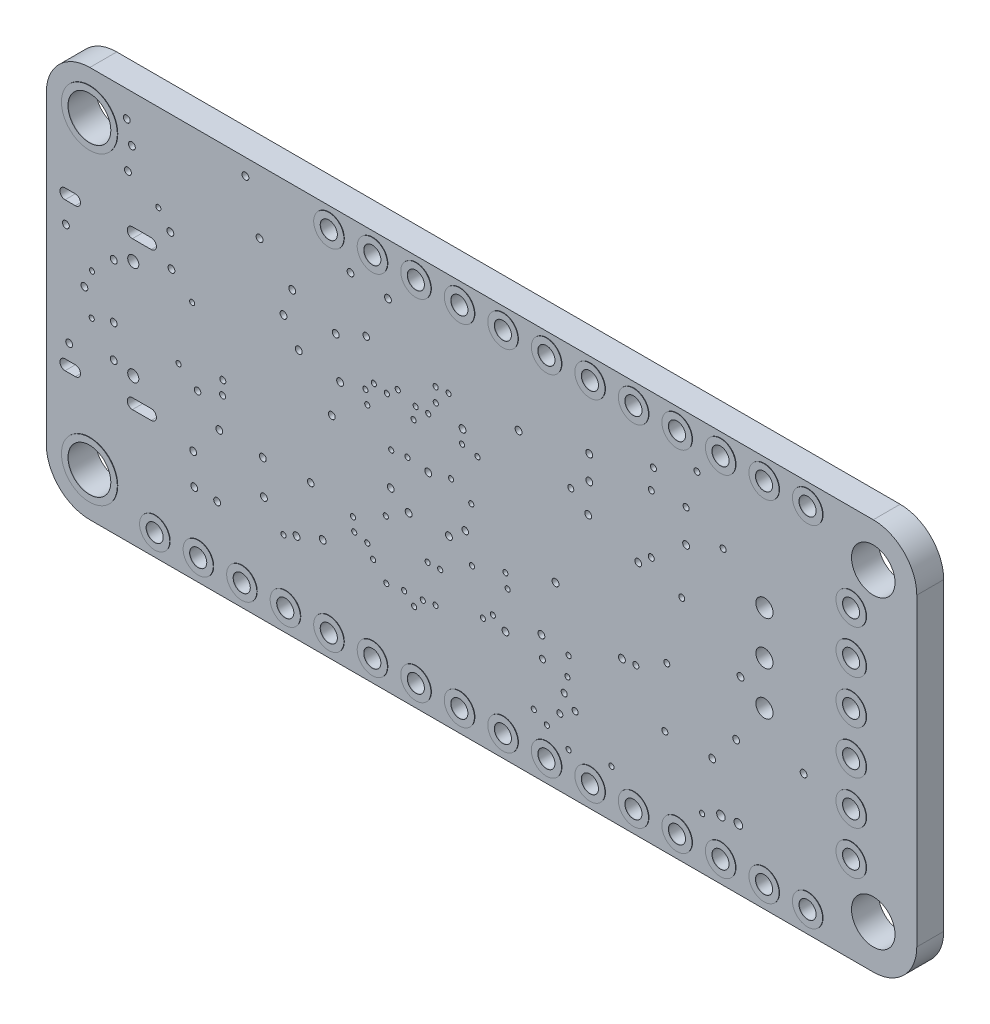
from build123d import *

# Parameters (mm, degrees)
SKETCH1_R              = 1.27
SKETCH1_R_2            = 0.5
SKETCH1_R_3            = 0.325
SKETCH1_R_4            = 1.25
SKETCH1_R_5            = 0.175
SKETCH1_R_6            = 0.15
SKETCH1_R_7            = 0.197
SKETCH1_R_8            = 0.1905
SKETCH1_R_9            = 0.2
SKETCH1_R_10           = 0.25
BOSS_EXTRUDE1_DEPTH    = 1.57
SKETCH2_R              = 0.881
SKETCH2_R_2            = 0.5
BOSS_EXTRUDE2_DEPTH    = 0.0254
BOSS_EXTRUDE2_2_DEPTH  = 0.0254
BOSS_EXTRUDE2_3_DEPTH  = 0.0254
BOSS_EXTRUDE2_4_DEPTH  = 0.0254
BOSS_EXTRUDE2_5_DEPTH  = 0.0254
BOSS_EXTRUDE2_6_DEPTH  = 0.0254
BOSS_EXTRUDE2_7_DEPTH  = 0.0254
BOSS_EXTRUDE2_8_DEPTH  = 0.0254
BOSS_EXTRUDE2_9_DEPTH  = 0.0254
BOSS_EXTRUDE2_10_DEPTH = 0.0254
BOSS_EXTRUDE2_11_DEPTH = 0.0254
BOSS_EXTRUDE2_12_DEPTH = 0.0254
BOSS_EXTRUDE2_13_DEPTH = 0.0254
BOSS_EXTRUDE2_14_DEPTH = 0.0254
BOSS_EXTRUDE2_15_DEPTH = 0.0254
BOSS_EXTRUDE2_16_DEPTH = 0.0254
BOSS_EXTRUDE2_17_DEPTH = 0.0254
BOSS_EXTRUDE2_18_DEPTH = 0.0254
BOSS_EXTRUDE2_19_DEPTH = 0.0254
BOSS_EXTRUDE2_20_DEPTH = 0.0254
BOSS_EXTRUDE2_21_DEPTH = 0.0254
BOSS_EXTRUDE2_22_DEPTH = 0.0254
BOSS_EXTRUDE2_23_DEPTH = 0.0254
BOSS_EXTRUDE2_24_DEPTH = 0.0254
BOSS_EXTRUDE2_25_DEPTH = 0.0254
BOSS_EXTRUDE2_26_DEPTH = 0.0254
BOSS_EXTRUDE2_27_DEPTH = 0.0254
BOSS_EXTRUDE2_28_DEPTH = 0.0254
BOSS_EXTRUDE2_29_DEPTH = 0.0254
BOSS_EXTRUDE2_30_DEPTH = 0.0254
BOSS_EXTRUDE2_31_DEPTH = 0.0254
BOSS_EXTRUDE2_32_DEPTH = 0.0254
BOSS_EXTRUDE2_33_DEPTH = 0.0254
BOSS_EXTRUDE2_34_DEPTH = 0.0254
SKETCH2_R_3            = 1.631
SKETCH2_R_4            = 1.25
BOSS_EXTRUDE2_35_DEPTH = 0.0254
BOSS_EXTRUDE2_36_DEPTH = 0.0254


with BuildPart() as part:
    # Sketch1 → Boss-Extrude1 (new body)
    with BuildSketch(Plane(origin=(0, 0, 0), x_dir=(-1, 0, 0), z_dir=(0, 0, -1))):
        with BuildLine():
            Line((0, 2.54), (0, 20.32))
            ThreePointArc((0, 20.32), (-0.743948776, 22.116051224), (-2.54, 22.86))
            Line((-2.54, 22.86), (-48.26, 22.86))
            ThreePointArc((-48.26, 22.86), (-50.056051224, 22.116051224), (-50.8, 20.32))
            Line((-50.8, 20.32), (-50.8, 2.54))
            ThreePointArc((-50.8, 2.54), (-50.056051224, 0.743948776), (-48.26, 0))
            Line((-48.26, 0), (-2.54, 0))
            ThreePointArc((-2.54, 0), (-0.743948776, 0.743948776), (0, 2.54))
        make_face()
        with Locations(Location((-48.26, 2.54, 0), (0, 0, 180))):
            Circle(SKETCH1_R, mode=Mode.SUBTRACT)
        with Locations(Location((-48.26, 20.32, 0), (0, 0, 180))):
            Circle(SKETCH1_R, mode=Mode.SUBTRACT)
        with Locations(Location((-41.91, 15.24, 0), (0, 0, 180))):
            Circle(SKETCH1_R_2, mode=Mode.SUBTRACT)
        with Locations(Location((-41.91, 10.16, 0), (0, 0, 180))):
            Circle(SKETCH1_R_2, mode=Mode.SUBTRACT)
        with Locations(Location((-46.99, 7.62, 0), (0, 0, 180))):
            Circle(SKETCH1_R_2, mode=Mode.SUBTRACT)
        with Locations(Location((-46.99, 12.7, 0), (0, 0, 180))):
            Circle(SKETCH1_R_2, mode=Mode.SUBTRACT)
        with Locations(Location((-46.99, 17.78, 0), (0, 0, 180))):
            Circle(SKETCH1_R_2, mode=Mode.SUBTRACT)
        with Locations(Location((-5.074, 8.54, 0), (0, 0, 180))):
            Circle(SKETCH1_R_3, mode=Mode.SUBTRACT)
        with Locations(Location((-41.91, 21.654, 0), (0, 0, 180))):
            Circle(SKETCH1_R_2, mode=Mode.SUBTRACT)
        with Locations(Location((-36.83, 21.654, 0), (0, 0, 180))):
            Circle(SKETCH1_R_2, mode=Mode.SUBTRACT)
        with Locations(Location((-31.75, 21.654, 0), (0, 0, 180))):
            Circle(SKETCH1_R_2, mode=Mode.SUBTRACT)
        with Locations(Location((-26.67, 21.654, 0), (0, 0, 180))):
            Circle(SKETCH1_R_2, mode=Mode.SUBTRACT)
        with Locations(Location((-21.59, 21.654, 0), (0, 0, 180))):
            Circle(SKETCH1_R_2, mode=Mode.SUBTRACT)
        with Locations(Location((-16.51, 21.654, 0), (0, 0, 180))):
            Circle(SKETCH1_R_2, mode=Mode.SUBTRACT)
        with Locations(Location((-8.89, 1.27, 0), (0, 0, 180))):
            Circle(SKETCH1_R_2, mode=Mode.SUBTRACT)
        with Locations(Location((-13.97, 1.27, 0), (0, 0, 180))):
            Circle(SKETCH1_R_2, mode=Mode.SUBTRACT)
        with Locations(Location((-19.05, 1.27, 0), (0, 0, 180))):
            Circle(SKETCH1_R_2, mode=Mode.SUBTRACT)
        with Locations(Location((-24.13, 1.27, 0), (0, 0, 180))):
            Circle(SKETCH1_R_2, mode=Mode.SUBTRACT)
        with Locations(Location((-29.21, 1.27, 0), (0, 0, 180))):
            Circle(SKETCH1_R_2, mode=Mode.SUBTRACT)
        with Locations(Location((-34.29, 1.27, 0), (0, 0, 180))):
            Circle(SKETCH1_R_2, mode=Mode.SUBTRACT)
        with Locations(Location((-39.37, 1.27, 0), (0, 0, 180))):
            Circle(SKETCH1_R_2, mode=Mode.SUBTRACT)
        with Locations(Location((-44.45, 1.27, 0), (0, 0, 180))):
            Circle(SKETCH1_R_2, mode=Mode.SUBTRACT)
        with Locations(Location((-2.54, 20.32, 0), (0, 0, 180))):
            Circle(SKETCH1_R_4, mode=Mode.SUBTRACT)
        with Locations(Location((-37.084, 13.335, 0), (0, 0, 180))):
            Circle(SKETCH1_R_5, mode=Mode.SUBTRACT)
        with Locations(Location((-30.416, 5.997, 0), (0, 0, 180))):
            Circle(SKETCH1_R_6, mode=Mode.SUBTRACT)
        with Locations(Location((-30.861, 4.488, 0), (0, 0, 180))):
            Circle(SKETCH1_R_5, mode=Mode.SUBTRACT)
        with Locations(Location((-29.969, 3.92, 0), (0, 0, 180))):
            Circle(SKETCH1_R_5, mode=Mode.SUBTRACT)
        with Locations(Location((-36.101, 6.087, 0), (0, 0, 180))):
            Circle(SKETCH1_R_5, mode=Mode.SUBTRACT)
        with Locations(Location((-17.97, 7.099, 0), (0, 0, 180))):
            Circle(SKETCH1_R_6, mode=Mode.SUBTRACT)
        with Locations(Location((-18.732, 6.922, 0), (0, 0, 180))):
            Circle(SKETCH1_R_6, mode=Mode.SUBTRACT)
        with Locations(Location((-17.9, 7.831, 0), (0, 0, 180))):
            Circle(SKETCH1_R_6, mode=Mode.SUBTRACT)
        with Locations(Location((-21.971, 5.652, 0), (0, 0, 180))):
            Circle(SKETCH1_R_6, mode=Mode.SUBTRACT)
        with Locations(Location((-39.497, 17.018, 0), (0, 0, 180))):
            Circle(SKETCH1_R_5, mode=Mode.SUBTRACT)
        with Locations(Location((-30.223, 5.083, 0), (0, 0, 180))):
            Circle(SKETCH1_R_5, mode=Mode.SUBTRACT)
        with Locations(Location((-13.843, 4.89, 0), (0, 0, 180))):
            Circle(SKETCH1_R_6, mode=Mode.SUBTRACT)
        with Locations(Location((-2.667, 12.636, 0), (0, 0, 180))):
            Circle(SKETCH1_R_6, mode=Mode.SUBTRACT)
        with Locations(Location((-26.06, 6.947, 0), (0, 0, 180))):
            Circle(SKETCH1_R_6, mode=Mode.SUBTRACT)
        with Locations(Location((-24.259, 14.685, 0), (0, 0, 180))):
            Circle(SKETCH1_R_6, mode=Mode.SUBTRACT)
        with Locations(Location((-24.846, 8.826, 0), (0, 0, 180))):
            Circle(SKETCH1_R_6, mode=Mode.SUBTRACT)
        with Locations(Location((-28.956, 6.167, 0), (0, 0, 180))):
            Circle(SKETCH1_R_5, mode=Mode.SUBTRACT)
        with Locations(Location((-32.984, 2.766, 0), (0, 0, 180))):
            Circle(SKETCH1_R_6, mode=Mode.SUBTRACT)
        with Locations(Location((-23.622, 12.609, 0), (0, 0, 180))):
            Circle(SKETCH1_R_6, mode=Mode.SUBTRACT)
        with Locations(Location((-22.72, 5.766, 0), (0, 0, 180))):
            Circle(SKETCH1_R_6, mode=Mode.SUBTRACT)
        with Locations(Location((-4.699, 21.336, 0), (0, 0, 180))):
            Circle(SKETCH1_R_7, mode=Mode.SUBTRACT)
        with Locations(Location((-26.924, 8.694, 0), (0, 0, 180))):
            Circle(SKETCH1_R_6, mode=Mode.SUBTRACT)
        with Locations(Location((-26.792, 9.452, 0), (0, 0, 180))):
            Circle(SKETCH1_R_6, mode=Mode.SUBTRACT)
        with Locations(Location((-22.728, 16.002, 0), (0, 0, 180))):
            Circle(SKETCH1_R_6, mode=Mode.SUBTRACT)
        with Locations(Location((-20.51, 15.558, 0), (0, 0, 180))):
            Circle(SKETCH1_R_6, mode=Mode.SUBTRACT)
        with Locations(Location((-23.479, 16.86, 0), (0, 0, 180))):
            Circle(SKETCH1_R_6, mode=Mode.SUBTRACT)
        with Locations(Location((-37.338, 18.034, 0), (0, 0, 180))):
            Circle(SKETCH1_R_5, mode=Mode.SUBTRACT)
        with Locations(Location((-22.722, 16.814, 0), (0, 0, 180))):
            Circle(SKETCH1_R_6, mode=Mode.SUBTRACT)
        with Locations(Location((-18.732, 13.906, 0), (0, 0, 180))):
            Circle(SKETCH1_R_6, mode=Mode.SUBTRACT)
        with Locations(Location((-18.669, 17.336, 0), (0, 0, 180))):
            Circle(SKETCH1_R_8, mode=Mode.SUBTRACT)
        with Locations(Location((-4.762, 18.732, 0), (0, 0, 180))):
            Circle(SKETCH1_R_9, mode=Mode.SUBTRACT)
        with Locations(Location((-3.937, 8.763, 0), (0, 0, 180))):
            Circle(SKETCH1_R_9, mode=Mode.SUBTRACT)
        with Locations(Location((-35.306, 14.478, 0), (0, 0, 180))):
            Circle(SKETCH1_R_5, mode=Mode.SUBTRACT)
        with Locations(Location((-24.29, 15.466, 0), (0, 0, 180))):
            Circle(SKETCH1_R_9, mode=Mode.SUBTRACT)
        with Locations(Location((-15.43, 8.318, 0), (0, 0, 180))):
            Circle(SKETCH1_R_8, mode=Mode.SUBTRACT)
        with Locations(Location((-16.662, 12.333, 0), (0, 0, 180))):
            Circle(SKETCH1_R_7, mode=Mode.SUBTRACT)
        with Locations(Location((-19.114, 15.176, 0), (0, 0, 180))):
            Circle(SKETCH1_R_6, mode=Mode.SUBTRACT)
        with Locations(Location((-22.255, 7.711, 0), (0, 0, 180))):
            Circle(SKETCH1_R_6, mode=Mode.SUBTRACT)
        with Locations(Location((-21.553, 15.233, 0), (0, 0, 180))):
            Circle(SKETCH1_R_6, mode=Mode.SUBTRACT)
        with Locations(Location((-44.196, 8.001, 0), (0, 0, 180))):
            Circle(SKETCH1_R_9, mode=Mode.SUBTRACT)
        with Locations(Location((-40.513, 11.049, 0), (0, 0, 180))):
            Circle(SKETCH1_R_9, mode=Mode.SUBTRACT)
        with Locations(Location((-26.797, 6.477, 0), (0, 0, 180))):
            Circle(SKETCH1_R_9, mode=Mode.SUBTRACT)
        with Locations(Location((-37.338, 16.129, 0), (0, 0, 180))):
            Circle(SKETCH1_R_9, mode=Mode.SUBTRACT)
        with Locations(Location((-38.862, 6.096, 0), (0, 0, 180))):
            Circle(SKETCH1_R_9, mode=Mode.SUBTRACT)
        with Locations(Location((-31.686, 17.907, 0), (0, 0, 180))):
            Circle(SKETCH1_R_9, mode=Mode.SUBTRACT)
        with Locations(Location((-31.623, 14.796, 0), (0, 0, 180))):
            Circle(SKETCH1_R_9, mode=Mode.SUBTRACT)
        with Locations(Location((-12.446, 19.177, 0), (0, 0, 180))):
            Circle(SKETCH1_R_9, mode=Mode.SUBTRACT)
        with Locations(Location((-7.302, 15.05, 0), (0, 0, 180))):
            Circle(SKETCH1_R_9, mode=Mode.SUBTRACT)
        with Locations(Location((-1.143, 14.224, 0), (0, 0, 180))):
            Circle(SKETCH1_R_9, mode=Mode.SUBTRACT)
        with Locations(Location((-2.222, 11.62, 0), (0, 0, 180))):
            Circle(SKETCH1_R_9, mode=Mode.SUBTRACT)
        with Locations(Location((-14.605, 5.207, 0), (0, 0, 180))):
            Circle(SKETCH1_R_9, mode=Mode.SUBTRACT)
        with Locations(Location((-14.732, 14.668, 0), (0, 0, 180))):
            Circle(SKETCH1_R_9, mode=Mode.SUBTRACT)
        with Locations(Location((-12.636, 8.192, 0), (0, 0, 180))):
            Circle(SKETCH1_R_9, mode=Mode.SUBTRACT)
        with Locations(Location((-16.891, 16.574, 0), (0, 0, 180))):
            Circle(SKETCH1_R_9, mode=Mode.SUBTRACT)
        with Locations(Location((-28.892, 7.366, 0), (0, 0, 180))):
            Circle(SKETCH1_R_9, mode=Mode.SUBTRACT)
        with Locations(Location((-23.495, 9.652, 0), (0, 0, 180))):
            Circle(SKETCH1_R_9, mode=Mode.SUBTRACT)
        with Locations(Location((-12.7, 6.223, 0), (0, 0, 180))):
            Circle(SKETCH1_R_9, mode=Mode.SUBTRACT)
        with Locations(Location((-8.572, 6.477, 0), (0, 0, 180))):
            Circle(SKETCH1_R_9, mode=Mode.SUBTRACT)
        with Locations(Location((-4.995, 20.13, 0), (0, 0, 180))):
            Circle(SKETCH1_R_9, mode=Mode.SUBTRACT)
        with Locations(Location((-10.096, 8.318, 0), (0, 0, 180))):
            Circle(SKETCH1_R_9, mode=Mode.SUBTRACT)
        with Locations(Location((-9.97, 4.636, 0), (0, 0, 180))):
            Circle(SKETCH1_R_9, mode=Mode.SUBTRACT)
        with Locations(Location((-16.129, 5.778, 0), (0, 0, 180))):
            Circle(SKETCH1_R_9, mode=Mode.SUBTRACT)
        with Locations(Location((-21.146, 9.652, 0), (0, 0, 180))):
            Circle(SKETCH1_R_9, mode=Mode.SUBTRACT)
        with Locations(Location((-13.843, 16.002, 0), (0, 0, 180))):
            Circle(SKETCH1_R_9, mode=Mode.SUBTRACT)
        with Locations(Location((-27.559, 17.018, 0), (0, 0, 180))):
            Circle(SKETCH1_R_9, mode=Mode.SUBTRACT)
        with Locations(Location((-17.145, 14.262, 0), (0, 0, 180))):
            Circle(SKETCH1_R_9, mode=Mode.SUBTRACT)
        with Locations(Location((-8.636, 4.699, 0), (0, 0, 180))):
            Circle(SKETCH1_R_9, mode=Mode.SUBTRACT)
        with Locations(Location((-22.288, 12.268, 0), (0, 0, 180))):
            Circle(SKETCH1_R_9, mode=Mode.SUBTRACT)
        with Locations(Location((-1.334, 8.318, 0), (0, 0, 180))):
            Circle(SKETCH1_R_9, mode=Mode.SUBTRACT)
        with Locations(Location((-7.239, 16.891, 0), (0, 0, 180))):
            Circle(SKETCH1_R_9, mode=Mode.SUBTRACT)
        with Locations(Location((-19.939, 19.876, 0), (0, 0, 180))):
            Circle(SKETCH1_R_9, mode=Mode.SUBTRACT)
        with Locations(Location((-14.351, 17.526, 0), (0, 0, 180))):
            Circle(SKETCH1_R_9, mode=Mode.SUBTRACT)
        with Locations(Location((-31.686, 16.51, 0), (0, 0, 180))):
            Circle(SKETCH1_R_9, mode=Mode.SUBTRACT)
        with Locations(Location((-29.718, 10.414, 0), (0, 0, 180))):
            Circle(SKETCH1_R_9, mode=Mode.SUBTRACT)
        with Locations(Location((-40.386, 3.556, 0), (0, 0, 180))):
            Circle(SKETCH1_R_10, mode=Mode.SUBTRACT)
        with Locations(Location((-33.592, 8.509, 0), (0, 0, 180))):
            Circle(SKETCH1_R_9, mode=Mode.SUBTRACT)
        with Locations(Location((-34.544, 13.843, 0), (0, 0, 180))):
            Circle(SKETCH1_R_9, mode=Mode.SUBTRACT)
        with Locations(Location((-40.259, 7.747, 0), (0, 0, 180))):
            Circle(SKETCH1_R_9, mode=Mode.SUBTRACT)
        with Locations(Location((-20.13, 12.319, 0), (0, 0, 180))):
            Circle(SKETCH1_R_6, mode=Mode.SUBTRACT)
        with Locations(Location((-21.077, 12.429, 0), (0, 0, 180))):
            Circle(SKETCH1_R_6, mode=Mode.SUBTRACT)
        with Locations(Location((-25.477, 6.496, 0), (0, 0, 180))):
            Circle(SKETCH1_R_6, mode=Mode.SUBTRACT)
        with Locations(Location((-18.624, 14.631, 0), (0, 0, 180))):
            Circle(SKETCH1_R_6, mode=Mode.SUBTRACT)
        with Locations(Location((-20.098, 10.382, 0), (0, 0, 180))):
            Circle(SKETCH1_R_7, mode=Mode.SUBTRACT)
        with Locations(Location((-24.447, 10.401, 0), (0, 0, 180))):
            Circle(SKETCH1_R_8, mode=Mode.SUBTRACT)
        with Locations(Location((-30.607, 15.629, 0), (0, 0, 180))):
            Circle(SKETCH1_R_5, mode=Mode.SUBTRACT)
        with Locations(Location((-3.937, 13.843, 0), (0, 0, 180))):
            Circle(SKETCH1_R_9, mode=Mode.SUBTRACT)
        with Locations(Location((-3.937, 10.668, 0), (0, 0, 180))):
            Circle(SKETCH1_R_9, mode=Mode.SUBTRACT)
        with Locations(Location((-8.826, 9.652, 0), (0, 0, 180))):
            Circle(SKETCH1_R_8, mode=Mode.SUBTRACT)
        with Locations(Location((-10.302, 10.942, 0), (0, 0, 180))):
            Circle(SKETCH1_R_5, mode=Mode.SUBTRACT)
        with Locations(Location((-6.54, 17.78, 0), (0, 0, 180))):
            Circle(SKETCH1_R_6, mode=Mode.SUBTRACT)
        with Locations(Location((-35.306, 17.872, 0), (0, 0, 180))):
            Circle(SKETCH1_R_5, mode=Mode.SUBTRACT)
        with Locations(Location((-37.973, 20.152, 0), (0, 0, 180))):
            Circle(SKETCH1_R_5, mode=Mode.SUBTRACT)
        with Locations(Location((-35.433, 19.075, 0), (0, 0, 180))):
            Circle(SKETCH1_R_5, mode=Mode.SUBTRACT)
        with Locations(Location((-22.288, 15.24, 0), (0, 0, 180))):
            Circle(SKETCH1_R_6, mode=Mode.SUBTRACT)
        with Locations(Location((-19.876, 15.05, 0), (0, 0, 180))):
            Circle(SKETCH1_R_6, mode=Mode.SUBTRACT)
        with Locations(Location((-7.722, 10.478, 0), (0, 0, 180))):
            Circle(SKETCH1_R_6, mode=Mode.SUBTRACT)
        with Locations(Location((-8.509, 13.97, 0), (0, 0, 180))):
            Circle(SKETCH1_R_6, mode=Mode.SUBTRACT)
        with Locations(Location((-17.753, 20.093, 0), (0, 0, 180))):
            Circle(SKETCH1_R_7, mode=Mode.SUBTRACT)
        with Locations(Location((-24.801, 11.938, 0), (0, 0, 180))):
            Circle(SKETCH1_R_6, mode=Mode.SUBTRACT)
        with Locations(Location((-11.62, 21.908, 0), (0, 0, 180))):
            Circle(SKETCH1_R_9, mode=Mode.SUBTRACT)
        with Locations(Location((-38.269, 3.02, 0), (0, 0, 180))):
            Circle(SKETCH1_R_6, mode=Mode.SUBTRACT)
        with Locations(Location((-19.812, 8.826, 0), (0, 0, 180))):
            Circle(SKETCH1_R_6, mode=Mode.SUBTRACT)
        with Locations(Location((-25.163, 14.502, 0), (0, 0, 180))):
            Circle(SKETCH1_R_6, mode=Mode.SUBTRACT)
        with Locations(Location((-22.987, 7.711, 0), (0, 0, 180))):
            Circle(SKETCH1_R_6, mode=Mode.SUBTRACT)
        with Locations(Location((-2.65, 10.24, 0), (0, 0, 180))):
            Circle(SKETCH1_R_6, mode=Mode.SUBTRACT)
        with Locations(Location((-21.432, 14.506, 0), (0, 0, 180))):
            Circle(SKETCH1_R_6, mode=Mode.SUBTRACT)
        with Locations(Location((-20.884, 5.588, 0), (0, 0, 180))):
            Circle(SKETCH1_R_6, mode=Mode.SUBTRACT)
        with Locations(Location((-36.21, 9.588, 0), (0, 0, 180))):
            Circle(SKETCH1_R_5, mode=Mode.SUBTRACT)
        with Locations(Location((-39.37, 3.463, 0), (0, 0, 180))):
            Circle(SKETCH1_R_10, mode=Mode.SUBTRACT)
        with Locations(Location((-30.48, 7.112, 0), (0, 0, 180))):
            Circle(SKETCH1_R_6, mode=Mode.SUBTRACT)
        with Locations(Location((-30.48, 2.35, 0), (0, 0, 180))):
            Circle(SKETCH1_R_6, mode=Mode.SUBTRACT)
        with Locations(Location((-28.448, 3.373, 0), (0, 0, 180))):
            Circle(SKETCH1_R_6, mode=Mode.SUBTRACT)
        with Locations(Location((-29.21, 2.957, 0), (0, 0, 180))):
            Circle(SKETCH1_R_6, mode=Mode.SUBTRACT)
        with Locations(Location((-19.071, 6.262, 0), (0, 0, 180))):
            Circle(SKETCH1_R_6, mode=Mode.SUBTRACT)
        with Locations(Location((-19.842, 5.434, 0), (0, 0, 180))):
            Circle(SKETCH1_R_6, mode=Mode.SUBTRACT)
        with Locations(Location((-21.463, 5.08, 0), (0, 0, 180))):
            Circle(SKETCH1_R_6, mode=Mode.SUBTRACT)
        with Locations(Location((-34.406, 8.583, 0), (0, 0, 180))):
            Circle(SKETCH1_R_5, mode=Mode.SUBTRACT)
        with Locations(Location((-10.287, 10.16, 0), (0, 0, 180))):
            Circle(SKETCH1_R_5, mode=Mode.SUBTRACT)
        with Locations(Location((-2.54, 2.54, 0), (0, 0, 180))):
            Circle(SKETCH1_R_4, mode=Mode.SUBTRACT)
        with Locations(Location((-41.91, 1.27, 0), (0, 0, 180))):
            Circle(SKETCH1_R_2, mode=Mode.SUBTRACT)
        with Locations(Location((-36.83, 1.27, 0), (0, 0, 180))):
            Circle(SKETCH1_R_2, mode=Mode.SUBTRACT)
        with Locations(Location((-31.75, 1.27, 0), (0, 0, 180))):
            Circle(SKETCH1_R_2, mode=Mode.SUBTRACT)
        with Locations(Location((-26.67, 1.27, 0), (0, 0, 180))):
            Circle(SKETCH1_R_2, mode=Mode.SUBTRACT)
        with Locations(Location((-21.59, 1.27, 0), (0, 0, 180))):
            Circle(SKETCH1_R_2, mode=Mode.SUBTRACT)
        with Locations(Location((-16.51, 1.27, 0), (0, 0, 180))):
            Circle(SKETCH1_R_2, mode=Mode.SUBTRACT)
        with Locations(Location((-11.43, 1.27, 0), (0, 0, 180))):
            Circle(SKETCH1_R_2, mode=Mode.SUBTRACT)
        with Locations(Location((-6.35, 1.27, 0), (0, 0, 180))):
            Circle(SKETCH1_R_2, mode=Mode.SUBTRACT)
        with Locations(Location((-19.05, 21.654, 0), (0, 0, 180))):
            Circle(SKETCH1_R_2, mode=Mode.SUBTRACT)
        with Locations(Location((-24.13, 21.654, 0), (0, 0, 180))):
            Circle(SKETCH1_R_2, mode=Mode.SUBTRACT)
        with Locations(Location((-29.21, 21.654, 0), (0, 0, 180))):
            Circle(SKETCH1_R_2, mode=Mode.SUBTRACT)
        with Locations(Location((-34.29, 21.654, 0), (0, 0, 180))):
            Circle(SKETCH1_R_2, mode=Mode.SUBTRACT)
        with Locations(Location((-39.37, 21.654, 0), (0, 0, 180))):
            Circle(SKETCH1_R_2, mode=Mode.SUBTRACT)
        with Locations(Location((-44.45, 21.654, 0), (0, 0, 180))):
            Circle(SKETCH1_R_2, mode=Mode.SUBTRACT)
        with Locations(Location((-5.074, 14.32, 0), (0, 0, 180))):
            Circle(SKETCH1_R_3, mode=Mode.SUBTRACT)
        with Locations(Location((-46.99, 15.24, 0), (0, 0, 180))):
            Circle(SKETCH1_R_2, mode=Mode.SUBTRACT)
        with Locations(Location((-46.99, 10.16, 0), (0, 0, 180))):
            Circle(SKETCH1_R_2, mode=Mode.SUBTRACT)
        with Locations(Location((-46.99, 5.08, 0), (0, 0, 180))):
            Circle(SKETCH1_R_2, mode=Mode.SUBTRACT)
        with Locations(Location((-41.91, 12.7, 0), (0, 0, 180))):
            Circle(SKETCH1_R_2, mode=Mode.SUBTRACT)
        with BuildLine():
            Line((-5.024, 6.81), (-6.124, 6.81))
            ThreePointArc((-6.124, 6.81), (-6.424, 7.11), (-6.124, 7.41))
            Line((-6.124, 7.41), (-5.024, 7.41))
            ThreePointArc((-5.024, 7.41), (-4.724, 7.11), (-5.024, 6.81))
        make_face(mode=Mode.SUBTRACT)
        with BuildLine():
            Line((-1.694, 16.05), (-1.094, 16.05))
            ThreePointArc((-1.094, 16.05), (-0.794, 15.75), (-1.094, 15.45))
            Line((-1.094, 15.45), (-1.694, 15.45))
            ThreePointArc((-1.694, 15.45), (-1.994, 15.75), (-1.694, 16.05))
        make_face(mode=Mode.SUBTRACT)
        with BuildLine():
            Line((-5.024, 15.45), (-6.124, 15.45))
            ThreePointArc((-6.124, 15.45), (-6.424, 15.75), (-6.124, 16.05))
            Line((-6.124, 16.05), (-5.024, 16.05))
            ThreePointArc((-5.024, 16.05), (-4.724, 15.75), (-5.024, 15.45))
        make_face(mode=Mode.SUBTRACT)
        with BuildLine():
            Line((-1.094, 6.81), (-1.694, 6.81))
            ThreePointArc((-1.694, 6.81), (-1.994, 7.11), (-1.694, 7.41))
            Line((-1.694, 7.41), (-1.094, 7.41))
            ThreePointArc((-1.094, 7.41), (-0.794, 7.11), (-1.094, 6.81))
        make_face(mode=Mode.SUBTRACT)
    extrude(amount=-BOSS_EXTRUDE1_DEPTH)


with BuildPart() as body_2:
    # Sketch2 → Boss-Extrude2 (new body)
    with BuildSketch(Plane.XY.offset(1.57)):
        with Locations((46.99, 5.08)):
            Circle(SKETCH2_R)
        with Locations((46.99, 5.08)):
            Circle(SKETCH2_R_2, mode=Mode.SUBTRACT)
    boss_extrude2 = extrude(amount=BOSS_EXTRUDE2_DEPTH)


with BuildPart() as body_3:
    # Sketch2 → Boss-Extrude2 2 (new body)
    with BuildSketch(Plane.XY.offset(1.57)):
        with Locations((46.99, 7.62)):
            Circle(SKETCH2_R)
        with Locations((46.99, 7.62)):
            Circle(SKETCH2_R_2, mode=Mode.SUBTRACT)
    boss_extrude2_2 = extrude(amount=BOSS_EXTRUDE2_2_DEPTH)


with BuildPart() as body_4:
    # Sketch2 → Boss-Extrude2 3 (new body)
    with BuildSketch(Plane.XY.offset(1.57)):
        with Locations((46.99, 10.16)):
            Circle(SKETCH2_R)
        with Locations((46.99, 10.16)):
            Circle(SKETCH2_R_2, mode=Mode.SUBTRACT)
    boss_extrude2_3 = extrude(amount=BOSS_EXTRUDE2_3_DEPTH)


with BuildPart() as body_5:
    # Sketch2 → Boss-Extrude2 4 (new body)
    with BuildSketch(Plane.XY.offset(1.57)):
        with Locations((46.99, 12.7)):
            Circle(SKETCH2_R)
        with Locations((46.99, 12.7)):
            Circle(SKETCH2_R_2, mode=Mode.SUBTRACT)
    boss_extrude2_4 = extrude(amount=BOSS_EXTRUDE2_4_DEPTH)


with BuildPart() as body_6:
    # Sketch2 → Boss-Extrude2 5 (new body)
    with BuildSketch(Plane.XY.offset(1.57)):
        with Locations((46.99, 15.24)):
            Circle(SKETCH2_R)
        with Locations((46.99, 15.24)):
            Circle(SKETCH2_R_2, mode=Mode.SUBTRACT)
    boss_extrude2_5 = extrude(amount=BOSS_EXTRUDE2_5_DEPTH)


with BuildPart() as body_7:
    # Sketch2 → Boss-Extrude2 6 (new body)
    with BuildSketch(Plane.XY.offset(1.57)):
        with Locations((46.99, 17.78)):
            Circle(SKETCH2_R)
        with Locations((46.99, 17.78)):
            Circle(SKETCH2_R_2, mode=Mode.SUBTRACT)
    boss_extrude2_6 = extrude(amount=BOSS_EXTRUDE2_6_DEPTH)


with BuildPart() as body_8:
    # Sketch2 → Boss-Extrude2 7 (new body)
    with BuildSketch(Plane.XY.offset(1.57)):
        with Locations((44.45, 1.27)):
            Circle(SKETCH2_R)
        with Locations((44.45, 1.27)):
            Circle(SKETCH2_R_2, mode=Mode.SUBTRACT)
    boss_extrude2_7 = extrude(amount=BOSS_EXTRUDE2_7_DEPTH)


with BuildPart() as body_9:
    # Sketch2 → Boss-Extrude2 8 (new body)
    with BuildSketch(Plane.XY.offset(1.57)):
        with Locations((41.91, 1.27)):
            Circle(SKETCH2_R)
        with Locations((41.91, 1.27)):
            Circle(SKETCH2_R_2, mode=Mode.SUBTRACT)
    boss_extrude2_8 = extrude(amount=BOSS_EXTRUDE2_8_DEPTH)


with BuildPart() as body_10:
    # Sketch2 → Boss-Extrude2 9 (new body)
    with BuildSketch(Plane.XY.offset(1.57)):
        with Locations((39.37, 1.27)):
            Circle(SKETCH2_R)
        with Locations((39.37, 1.27)):
            Circle(SKETCH2_R_2, mode=Mode.SUBTRACT)
    boss_extrude2_9 = extrude(amount=BOSS_EXTRUDE2_9_DEPTH)


with BuildPart() as body_11:
    # Sketch2 → Boss-Extrude2 10 (new body)
    with BuildSketch(Plane.XY.offset(1.57)):
        with Locations((36.83, 1.27)):
            Circle(SKETCH2_R)
        with Locations((36.83, 1.27)):
            Circle(SKETCH2_R_2, mode=Mode.SUBTRACT)
    boss_extrude2_10 = extrude(amount=BOSS_EXTRUDE2_10_DEPTH)


with BuildPart() as body_12:
    # Sketch2 → Boss-Extrude2 11 (new body)
    with BuildSketch(Plane.XY.offset(1.57)):
        with Locations((34.29, 1.27)):
            Circle(SKETCH2_R)
        with Locations((34.29, 1.27)):
            Circle(SKETCH2_R_2, mode=Mode.SUBTRACT)
    boss_extrude2_11 = extrude(amount=BOSS_EXTRUDE2_11_DEPTH)


with BuildPart() as body_13:
    # Sketch2 → Boss-Extrude2 12 (new body)
    with BuildSketch(Plane.XY.offset(1.57)):
        with Locations((31.75, 1.27)):
            Circle(SKETCH2_R)
        with Locations((31.75, 1.27)):
            Circle(SKETCH2_R_2, mode=Mode.SUBTRACT)
    boss_extrude2_12 = extrude(amount=BOSS_EXTRUDE2_12_DEPTH)


with BuildPart() as body_14:
    # Sketch2 → Boss-Extrude2 13 (new body)
    with BuildSketch(Plane.XY.offset(1.57)):
        with Locations((29.21, 1.27)):
            Circle(SKETCH2_R)
        with Locations((29.21, 1.27)):
            Circle(SKETCH2_R_2, mode=Mode.SUBTRACT)
    boss_extrude2_13 = extrude(amount=BOSS_EXTRUDE2_13_DEPTH)


with BuildPart() as body_15:
    # Sketch2 → Boss-Extrude2 14 (new body)
    with BuildSketch(Plane.XY.offset(1.57)):
        with Locations((26.67, 1.27)):
            Circle(SKETCH2_R)
        with Locations((26.67, 1.27)):
            Circle(SKETCH2_R_2, mode=Mode.SUBTRACT)
    boss_extrude2_14 = extrude(amount=BOSS_EXTRUDE2_14_DEPTH)


with BuildPart() as body_16:
    # Sketch2 → Boss-Extrude2 15 (new body)
    with BuildSketch(Plane.XY.offset(1.57)):
        with Locations((24.13, 1.27)):
            Circle(SKETCH2_R)
        with Locations((24.13, 1.27)):
            Circle(SKETCH2_R_2, mode=Mode.SUBTRACT)
    boss_extrude2_15 = extrude(amount=BOSS_EXTRUDE2_15_DEPTH)


with BuildPart() as body_17:
    # Sketch2 → Boss-Extrude2 16 (new body)
    with BuildSketch(Plane.XY.offset(1.57)):
        with Locations((21.59, 1.27)):
            Circle(SKETCH2_R)
        with Locations((21.59, 1.27)):
            Circle(SKETCH2_R_2, mode=Mode.SUBTRACT)
    boss_extrude2_16 = extrude(amount=BOSS_EXTRUDE2_16_DEPTH)


with BuildPart() as body_18:
    # Sketch2 → Boss-Extrude2 17 (new body)
    with BuildSketch(Plane.XY.offset(1.57)):
        with Locations((19.05, 1.27)):
            Circle(SKETCH2_R)
        with Locations((19.05, 1.27)):
            Circle(SKETCH2_R_2, mode=Mode.SUBTRACT)
    boss_extrude2_17 = extrude(amount=BOSS_EXTRUDE2_17_DEPTH)


with BuildPart() as body_19:
    # Sketch2 → Boss-Extrude2 18 (new body)
    with BuildSketch(Plane.XY.offset(1.57)):
        with Locations((16.51, 1.27)):
            Circle(SKETCH2_R)
        with Locations((16.51, 1.27)):
            Circle(SKETCH2_R_2, mode=Mode.SUBTRACT)
    boss_extrude2_18 = extrude(amount=BOSS_EXTRUDE2_18_DEPTH)


with BuildPart() as body_20:
    # Sketch2 → Boss-Extrude2 19 (new body)
    with BuildSketch(Plane.XY.offset(1.57)):
        with Locations((13.97, 1.27)):
            Circle(SKETCH2_R)
        with Locations((13.97, 1.27)):
            Circle(SKETCH2_R_2, mode=Mode.SUBTRACT)
    boss_extrude2_19 = extrude(amount=BOSS_EXTRUDE2_19_DEPTH)


with BuildPart() as body_21:
    # Sketch2 → Boss-Extrude2 20 (new body)
    with BuildSketch(Plane.XY.offset(1.57)):
        with Locations((11.43, 1.27)):
            Circle(SKETCH2_R)
        with Locations((11.43, 1.27)):
            Circle(SKETCH2_R_2, mode=Mode.SUBTRACT)
    boss_extrude2_20 = extrude(amount=BOSS_EXTRUDE2_20_DEPTH)


with BuildPart() as body_22:
    # Sketch2 → Boss-Extrude2 21 (new body)
    with BuildSketch(Plane.XY.offset(1.57)):
        with Locations((8.89, 1.27)):
            Circle(SKETCH2_R)
        with Locations((8.89, 1.27)):
            Circle(SKETCH2_R_2, mode=Mode.SUBTRACT)
    boss_extrude2_21 = extrude(amount=BOSS_EXTRUDE2_21_DEPTH)


with BuildPart() as body_23:
    # Sketch2 → Boss-Extrude2 22 (new body)
    with BuildSketch(Plane.XY.offset(1.57)):
        with Locations((6.35, 1.27)):
            Circle(SKETCH2_R)
        with Locations((6.35, 1.27)):
            Circle(SKETCH2_R_2, mode=Mode.SUBTRACT)
    boss_extrude2_22 = extrude(amount=BOSS_EXTRUDE2_22_DEPTH)


with BuildPart() as body_24:
    # Sketch2 → Boss-Extrude2 23 (new body)
    with BuildSketch(Plane.XY.offset(1.57)):
        with Locations((44.45, 21.654)):
            Circle(SKETCH2_R)
        with Locations((44.45, 21.654)):
            Circle(SKETCH2_R_2, mode=Mode.SUBTRACT)
    boss_extrude2_23 = extrude(amount=BOSS_EXTRUDE2_23_DEPTH)


with BuildPart() as body_25:
    # Sketch2 → Boss-Extrude2 24 (new body)
    with BuildSketch(Plane.XY.offset(1.57)):
        with Locations((41.91, 21.654)):
            Circle(SKETCH2_R)
        with Locations((41.91, 21.654)):
            Circle(SKETCH2_R_2, mode=Mode.SUBTRACT)
    boss_extrude2_24 = extrude(amount=BOSS_EXTRUDE2_24_DEPTH)


with BuildPart() as body_26:
    # Sketch2 → Boss-Extrude2 25 (new body)
    with BuildSketch(Plane.XY.offset(1.57)):
        with Locations((39.37, 21.654)):
            Circle(SKETCH2_R)
        with Locations((39.37, 21.654)):
            Circle(SKETCH2_R_2, mode=Mode.SUBTRACT)
    boss_extrude2_25 = extrude(amount=BOSS_EXTRUDE2_25_DEPTH)


with BuildPart() as body_27:
    # Sketch2 → Boss-Extrude2 26 (new body)
    with BuildSketch(Plane.XY.offset(1.57)):
        with Locations((36.83, 21.654)):
            Circle(SKETCH2_R)
        with Locations((36.83, 21.654)):
            Circle(SKETCH2_R_2, mode=Mode.SUBTRACT)
    boss_extrude2_26 = extrude(amount=BOSS_EXTRUDE2_26_DEPTH)


with BuildPart() as body_28:
    # Sketch2 → Boss-Extrude2 27 (new body)
    with BuildSketch(Plane.XY.offset(1.57)):
        with Locations((34.29, 21.654)):
            Circle(SKETCH2_R)
        with Locations((34.29, 21.654)):
            Circle(SKETCH2_R_2, mode=Mode.SUBTRACT)
    boss_extrude2_27 = extrude(amount=BOSS_EXTRUDE2_27_DEPTH)


with BuildPart() as body_29:
    # Sketch2 → Boss-Extrude2 28 (new body)
    with BuildSketch(Plane.XY.offset(1.57)):
        with Locations((31.75, 21.654)):
            Circle(SKETCH2_R)
        with Locations((31.75, 21.654)):
            Circle(SKETCH2_R_2, mode=Mode.SUBTRACT)
    boss_extrude2_28 = extrude(amount=BOSS_EXTRUDE2_28_DEPTH)


with BuildPart() as body_30:
    # Sketch2 → Boss-Extrude2 29 (new body)
    with BuildSketch(Plane.XY.offset(1.57)):
        with Locations((29.21, 21.654)):
            Circle(SKETCH2_R)
        with Locations((29.21, 21.654)):
            Circle(SKETCH2_R_2, mode=Mode.SUBTRACT)
    boss_extrude2_29 = extrude(amount=BOSS_EXTRUDE2_29_DEPTH)


with BuildPart() as body_31:
    # Sketch2 → Boss-Extrude2 30 (new body)
    with BuildSketch(Plane.XY.offset(1.57)):
        with Locations((26.67, 21.654)):
            Circle(SKETCH2_R)
        with Locations((26.67, 21.654)):
            Circle(SKETCH2_R_2, mode=Mode.SUBTRACT)
    boss_extrude2_30 = extrude(amount=BOSS_EXTRUDE2_30_DEPTH)


with BuildPart() as body_32:
    # Sketch2 → Boss-Extrude2 31 (new body)
    with BuildSketch(Plane.XY.offset(1.57)):
        with Locations((24.13, 21.654)):
            Circle(SKETCH2_R)
        with Locations((24.13, 21.654)):
            Circle(SKETCH2_R_2, mode=Mode.SUBTRACT)
    boss_extrude2_31 = extrude(amount=BOSS_EXTRUDE2_31_DEPTH)


with BuildPart() as body_33:
    # Sketch2 → Boss-Extrude2 32 (new body)
    with BuildSketch(Plane.XY.offset(1.57)):
        with Locations((21.59, 21.654)):
            Circle(SKETCH2_R)
        with Locations((21.59, 21.654)):
            Circle(SKETCH2_R_2, mode=Mode.SUBTRACT)
    boss_extrude2_32 = extrude(amount=BOSS_EXTRUDE2_32_DEPTH)


with BuildPart() as body_34:
    # Sketch2 → Boss-Extrude2 33 (new body)
    with BuildSketch(Plane.XY.offset(1.57)):
        with Locations((19.05, 21.654)):
            Circle(SKETCH2_R)
        with Locations((19.05, 21.654)):
            Circle(SKETCH2_R_2, mode=Mode.SUBTRACT)
    boss_extrude2_33 = extrude(amount=BOSS_EXTRUDE2_33_DEPTH)


with BuildPart() as body_35:
    # Sketch2 → Boss-Extrude2 34 (new body)
    with BuildSketch(Plane.XY.offset(1.57)):
        with Locations((16.51, 21.654)):
            Circle(SKETCH2_R)
        with Locations((16.51, 21.654)):
            Circle(SKETCH2_R_2, mode=Mode.SUBTRACT)
    boss_extrude2_34 = extrude(amount=BOSS_EXTRUDE2_34_DEPTH)


with BuildPart() as body_36:
    # Sketch2 → Boss-Extrude2 35 (new body)
    with BuildSketch(Plane.XY.offset(1.57)):
        with Locations((2.54, 2.54)):
            Circle(SKETCH2_R_3)
        with Locations((2.54, 2.54)):
            Circle(SKETCH2_R_4, mode=Mode.SUBTRACT)
    boss_extrude2_35 = extrude(amount=BOSS_EXTRUDE2_35_DEPTH)


with BuildPart() as body_37:
    # Sketch2 → Boss-Extrude2 36 (new body)
    with BuildSketch(Plane.XY.offset(1.57)):
        with Locations((2.54, 20.32)):
            Circle(SKETCH2_R_3)
        with Locations((2.54, 20.32)):
            Circle(SKETCH2_R_4, mode=Mode.SUBTRACT)
    boss_extrude2_36 = extrude(amount=BOSS_EXTRUDE2_36_DEPTH)


with BuildPart() as part_1:
    add(part.part)

    # Mirror1: Boss-Extrude2, Boss-Extrude2 2, Boss-Extrude2 3, Boss-Extrude2 4, Boss-Extrude2 5, Boss-Extrude2 6, Boss-Extrude2 7, Boss-Extrude2 8, Boss-Extrude2 9, Boss-Extrude2 10, Boss-Extrude2 11, Boss-Extrude2 12, Boss-Extrude2 13, Boss-Extrude2 14, Boss-Extrude2 15, Boss-Extrude2 16, Boss-Extrude2 17, Boss-Extrude2 18, Boss-Extrude2 19, Boss-Extrude2 20, Boss-Extrude2 21, Boss-Extrude2 22, Boss-Extrude2 23, Boss-Extrude2 24, Boss-Extrude2 25, Boss-Extrude2 26, Boss-Extrude2 27, Boss-Extrude2 28, Boss-Extrude2 29, Boss-Extrude2 30, Boss-Extrude2 31, Boss-Extrude2 32, Boss-Extrude2 33, Boss-Extrude2 34, Boss-Extrude2 35, Boss-Extrude2 36 across plane
    add(boss_extrude2.mirror(Plane(origin=(0, 0, 0.785), x_dir=(1, 0, 0), z_dir=(0, 0, -1))))
    add(boss_extrude2_2.mirror(Plane(origin=(0, 0, 0.785), x_dir=(1, 0, 0), z_dir=(0, 0, -1))))
    add(boss_extrude2_3.mirror(Plane(origin=(0, 0, 0.785), x_dir=(1, 0, 0), z_dir=(0, 0, -1))))
    add(boss_extrude2_4.mirror(Plane(origin=(0, 0, 0.785), x_dir=(1, 0, 0), z_dir=(0, 0, -1))))
    add(boss_extrude2_5.mirror(Plane(origin=(0, 0, 0.785), x_dir=(1, 0, 0), z_dir=(0, 0, -1))))
    add(boss_extrude2_6.mirror(Plane(origin=(0, 0, 0.785), x_dir=(1, 0, 0), z_dir=(0, 0, -1))))
    add(boss_extrude2_7.mirror(Plane(origin=(0, 0, 0.785), x_dir=(1, 0, 0), z_dir=(0, 0, -1))))
    add(boss_extrude2_8.mirror(Plane(origin=(0, 0, 0.785), x_dir=(1, 0, 0), z_dir=(0, 0, -1))))
    add(boss_extrude2_9.mirror(Plane(origin=(0, 0, 0.785), x_dir=(1, 0, 0), z_dir=(0, 0, -1))))
    add(boss_extrude2_10.mirror(Plane(origin=(0, 0, 0.785), x_dir=(1, 0, 0), z_dir=(0, 0, -1))))
    add(boss_extrude2_11.mirror(Plane(origin=(0, 0, 0.785), x_dir=(1, 0, 0), z_dir=(0, 0, -1))))
    add(boss_extrude2_12.mirror(Plane(origin=(0, 0, 0.785), x_dir=(1, 0, 0), z_dir=(0, 0, -1))))
    add(boss_extrude2_13.mirror(Plane(origin=(0, 0, 0.785), x_dir=(1, 0, 0), z_dir=(0, 0, -1))))
    add(boss_extrude2_14.mirror(Plane(origin=(0, 0, 0.785), x_dir=(1, 0, 0), z_dir=(0, 0, -1))))
    add(boss_extrude2_15.mirror(Plane(origin=(0, 0, 0.785), x_dir=(1, 0, 0), z_dir=(0, 0, -1))))
    add(boss_extrude2_16.mirror(Plane(origin=(0, 0, 0.785), x_dir=(1, 0, 0), z_dir=(0, 0, -1))))
    add(boss_extrude2_17.mirror(Plane(origin=(0, 0, 0.785), x_dir=(1, 0, 0), z_dir=(0, 0, -1))))
    add(boss_extrude2_18.mirror(Plane(origin=(0, 0, 0.785), x_dir=(1, 0, 0), z_dir=(0, 0, -1))))
    add(boss_extrude2_19.mirror(Plane(origin=(0, 0, 0.785), x_dir=(1, 0, 0), z_dir=(0, 0, -1))))
    add(boss_extrude2_20.mirror(Plane(origin=(0, 0, 0.785), x_dir=(1, 0, 0), z_dir=(0, 0, -1))))
    add(boss_extrude2_21.mirror(Plane(origin=(0, 0, 0.785), x_dir=(1, 0, 0), z_dir=(0, 0, -1))))
    add(boss_extrude2_22.mirror(Plane(origin=(0, 0, 0.785), x_dir=(1, 0, 0), z_dir=(0, 0, -1))))
    add(boss_extrude2_23.mirror(Plane(origin=(0, 0, 0.785), x_dir=(1, 0, 0), z_dir=(0, 0, -1))))
    add(boss_extrude2_24.mirror(Plane(origin=(0, 0, 0.785), x_dir=(1, 0, 0), z_dir=(0, 0, -1))))
    add(boss_extrude2_25.mirror(Plane(origin=(0, 0, 0.785), x_dir=(1, 0, 0), z_dir=(0, 0, -1))))
    add(boss_extrude2_26.mirror(Plane(origin=(0, 0, 0.785), x_dir=(1, 0, 0), z_dir=(0, 0, -1))))
    add(boss_extrude2_27.mirror(Plane(origin=(0, 0, 0.785), x_dir=(1, 0, 0), z_dir=(0, 0, -1))))
    add(boss_extrude2_28.mirror(Plane(origin=(0, 0, 0.785), x_dir=(1, 0, 0), z_dir=(0, 0, -1))))
    add(boss_extrude2_29.mirror(Plane(origin=(0, 0, 0.785), x_dir=(1, 0, 0), z_dir=(0, 0, -1))))
    add(boss_extrude2_30.mirror(Plane(origin=(0, 0, 0.785), x_dir=(1, 0, 0), z_dir=(0, 0, -1))))
    add(boss_extrude2_31.mirror(Plane(origin=(0, 0, 0.785), x_dir=(1, 0, 0), z_dir=(0, 0, -1))))
    add(boss_extrude2_32.mirror(Plane(origin=(0, 0, 0.785), x_dir=(1, 0, 0), z_dir=(0, 0, -1))))
    add(boss_extrude2_33.mirror(Plane(origin=(0, 0, 0.785), x_dir=(1, 0, 0), z_dir=(0, 0, -1))))
    add(boss_extrude2_34.mirror(Plane(origin=(0, 0, 0.785), x_dir=(1, 0, 0), z_dir=(0, 0, -1))))
    add(boss_extrude2_35.mirror(Plane(origin=(0, 0, 0.785), x_dir=(1, 0, 0), z_dir=(0, 0, -1))))
    add(boss_extrude2_36.mirror(Plane(origin=(0, 0, 0.785), x_dir=(1, 0, 0), z_dir=(0, 0, -1))))


solid = Compound([body_2.part, body_3.part, body_4.part, body_5.part, body_6.part, body_7.part, body_8.part, body_9.part, body_10.part, body_11.part, body_12.part, body_13.part, body_14.part, body_15.part, body_16.part, body_17.part, body_18.part, body_19.part, body_20.part, body_21.part, body_22.part, body_23.part, body_24.part, body_25.part, body_26.part, body_27.part, body_28.part, body_29.part, body_30.part, body_31.part, body_32.part, body_33.part, body_34.part, body_35.part, body_36.part, body_37.part, part_1.part])
